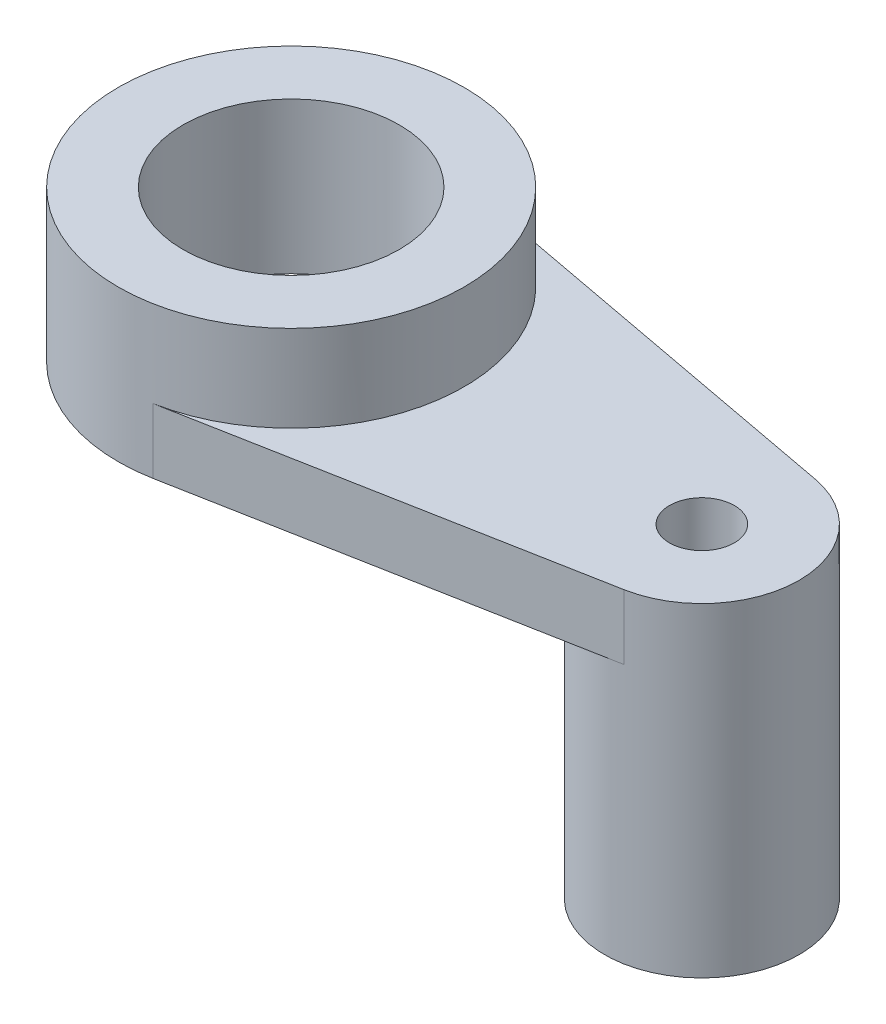
from build123d import *

# Parameters (mm, degrees)
SZKIC1_R                    = 10
DODANIE_WYCI_GNI_CIE2_DEPTH = 14
SZKIC1_5_R                  = 3
DODANIE_WYCI_GNI_CIE3_DEPTH = 6
DODANIE_WYCI_GNI_CIE4_START = 24
SZKIC2_R                    = 3
DODANIE_WYCI_GNI_CIE4_DEPTH = 24


with BuildPart() as part:
    # Szkic1 → Dodanie-wyciągnięcie2 (new body)
    with BuildSketch(Plane(origin=(0, 0, 0), x_dir=(1, 0, 0), z_dir=(0, 1, 0))):
        with BuildLine():
            ThreePointArc((16, 0), (12.311740225, 10.218661979), (2.947368421, 15.726188966))
            ThreePointArc((2.947368421, 15.726188966), (-16, 0), (2.947368421, -15.726188966))
            ThreePointArc((2.947368421, -15.726188966), (12.311740225, -10.218661979), (16, 0))
        make_face()
        Circle(SZKIC1_R, mode=Mode.SUBTRACT)
    extrude(amount=DODANIE_WYCI_GNI_CIE2_DEPTH)

    # Szkic1<5> → Dodanie-wyciągnięcie3 (add)
    with BuildSketch(Plane(origin=(0, 0, 0), x_dir=(1, 0, 0), z_dir=(0, 1, 0))):
        with BuildLine():
            Line((39.657894737, 8.845981293), (2.947368421, 15.726188966))
            ThreePointArc((2.947368421, 15.726188966), (12.311740225, 10.218661979), (16, 0))
            ThreePointArc((16, 0), (12.311740225, -10.218661979), (2.947368421, -15.726188966))
            Line((2.947368421, -15.726188966), (39.657894737, -8.845981293))
            ThreePointArc((39.657894737, -8.845981293), (47, 0), (39.657894737, 8.845981293))
        make_face()
        with Locations((38, 0)):
            Circle(SZKIC1_5_R, mode=Mode.SUBTRACT)
    extrude(amount=DODANIE_WYCI_GNI_CIE3_DEPTH)

    # Szkic2 → Dodanie-wyciągnięcie4 (add)
    with BuildSketch(Plane.XZ.offset(DODANIE_WYCI_GNI_CIE4_START)):
        with BuildLine():
            ThreePointArc((39.657894737, -8.845981293), (44.925353877, -5.747997363), (47, 0))
            ThreePointArc((47, 0), (44.925353877, 5.747997363), (39.657894737, 8.845981293))
            ThreePointArc((39.657894737, 8.845981293), (29, 0), (39.657894737, -8.845981293))
        make_face()
        with Locations((38, 0)):
            Circle(SZKIC2_R, mode=Mode.SUBTRACT)
    extrude(amount=-DODANIE_WYCI_GNI_CIE4_DEPTH)


solid = part.part
